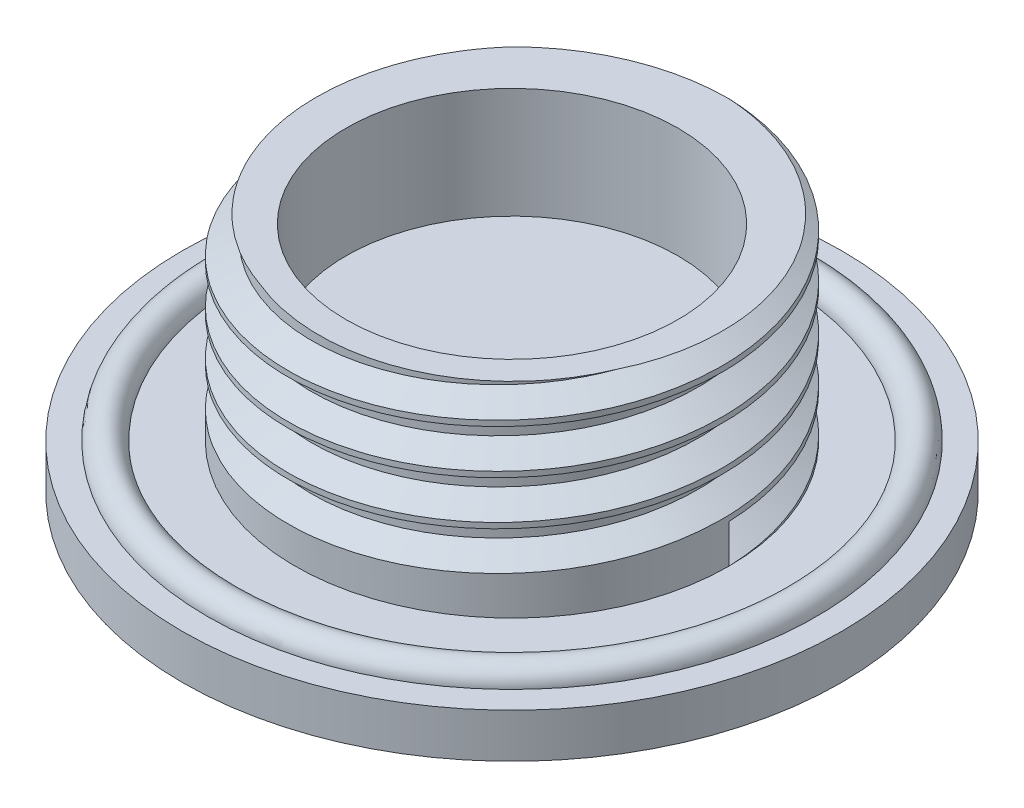
from build123d import *
from build123d.topology import SkipClean

# Parameters (mm, degrees)
SKETCH1_R           = 14.9
BOSS_EXTRUDE1_DEPTH = 2
SKETCH2_R           = 9.8
BOSS_EXTRUDE2_DEPTH = 8.5
SKETCH3_R           = 7.5
CUT_EXTRUDE1_DEPTH  = 5
THREAD1_PITCH       = 2
CUT_EXTRUDE2_START  = -3
SKETCH7_R           = 7.5
CUT_EXTRUDE2_DEPTH  = 3
SKETCH9_W           = 3.4
SKETCH9_H           = 17.333603835
BOSS_EXTRUDE3_DEPTH = 3
SKETCH10_R          = 0.75


with BuildPart() as part:
    # Sketch1 → Boss-Extrude1 (new body)
    with BuildSketch(Plane(origin=(0, 0, 0), x_dir=(1, 0, 0), z_dir=(0, 1, 0))):
        with Locations(Location((0, 0, 0), (0, 0, 270))):
            Circle(SKETCH1_R)
    extrude(amount=BOSS_EXTRUDE1_DEPTH)

    # Sketch2 → Boss-Extrude2 (add)
    with BuildSketch(Plane(origin=(0, 2, 0), x_dir=(1, 0, 0), z_dir=(0, 1, 0))):
        with Locations(Location((0, 0, 0), (0, 0, 270))):
            Circle(SKETCH2_R)
    extrude(amount=BOSS_EXTRUDE2_DEPTH)

    # Sketch3 → Cut-Extrude1 (cut)
    with BuildSketch(Plane(origin=(0, 10.5, 0), x_dir=(1, 0, 0), z_dir=(0, 1, 0))):
        with Locations(Location((0, 0, 0), (0, 0, 270))):
            Circle(SKETCH3_R)
    extrude(amount=-CUT_EXTRUDE1_DEPTH, mode=Mode.SUBTRACT)

    # Thread1: the profile of Sketch5 profile screwed along a right-hand helix of 5 turns, 10 arcs to a turn; built about Z, then put on its axis
    with SkipClean():  # the faces are left unmerged after this step: merging them gives an invalid solid
        thread1_z = Axis((0, 0, 0), (0, 0, 1))
        thread1_corners = [(9.8003, 0, -0.000173205), (9.8003, 0, 1.7501732), (8.71746825, 0, 1.124999997), (8.71746825, 0, 0.624999997)]
        with BuildLine(mode=Mode.PRIVATE) as thread1_profile:
            Line(thread1_corners[0], thread1_corners[1])
            Line(thread1_corners[1], thread1_corners[2])
            Line(thread1_corners[2], thread1_corners[3])
            Line(thread1_corners[3], thread1_corners[0])
        thread1_cap = Face(thread1_profile.wire())
        thread1_turn_angles = [0, 18, 36, 54, 72, 90, 108, 126, 144, 162, 180, 198, 216, 234, 252, 270, 288, 306, 324, 342, 360]
        thread1_turn_weights = [1, 0.9510565162951535, 1, 0.9510565162951535, 1, 0.9510565162951535, 1, 0.9510565162951535, 1, 0.9510565162951535, 1, 0.9510565162951535, 1, 0.9510565162951535, 1, 0.9510565162951535, 1, 0.9510565162951535, 1, 0.9510565162951535, 1]
        thread1_turn_rails = [Edge.make_bspline([Vector(p[0], p[1], 0).rotate(thread1_z, thread1_turn_angles[k]) / thread1_turn_weights[k] + Vector(0, 0, p[2] + THREAD1_PITCH * thread1_turn_angles[k] / 360) for k in range(21)], [0, 0, 0, 1, 1, 2, 2, 3, 3, 4, 4, 5, 5, 6, 6, 7, 7, 8, 8, 9, 9, 10, 10, 10], 2, thread1_turn_weights) for p in thread1_corners]
        thread1_turn_sides = [Face.make_surface_from_curves(thread1_turn_rails[p[0]], thread1_turn_rails[p[1]]) for p in [(0, 1), (1, 2), (2, 3), (3, 0)]]
        thread1 = Plane(origin=(0, 2, 0), x_dir=(1, 0, 0), z_dir=(0, 1, 0)) * Solid(Shell([*[p.moved(Location((0, 0, THREAD1_PITCH * i))) for i in range(5) for p in thread1_turn_sides], thread1_cap, thread1_cap.rotate(thread1_z, 1800).moved(Location((0, 0, THREAD1_PITCH * 1800 / 360)))]))
        add(thread1, mode=Mode.SUBTRACT)

    # Sketch7 → Cut-Extrude2 (cut)
    with SkipClean():  # the faces are left unmerged after this step: merging them gives an invalid solid
        with BuildSketch(Plane.XZ.offset(CUT_EXTRUDE2_START)):
            with Locations(Location((0, 0, 0), (0, 0, 90))):
                Circle(SKETCH7_R)
        extrude(amount=CUT_EXTRUDE2_DEPTH, mode=Mode.SUBTRACT)

    # Sketch9 → Boss-Extrude3 (add)
    with SkipClean():  # the faces are left unmerged after this step: merging them gives an invalid solid
        with BuildSketch(Plane.XZ.offset(-3)):
            with Locations((0, -0.102687227)):
                Rectangle(SKETCH9_W, SKETCH9_H)
        extrude(amount=BOSS_EXTRUDE3_DEPTH)

    # Sketch10 → Revolve1 (revolve)
    with SkipClean():  # the faces are left unmerged after this step: merging them gives an invalid solid
        with BuildSketch(Plane.XY, mode=Mode.PRIVATE) as revolve1_sk:
            with Locations((13, 2)):
                Circle(SKETCH10_R)
        revolve(revolve1_sk.sketch.rotate(Axis((0, 0, 0), (0, 1, 0)), 90), axis=Axis((0, 0, 0), (0, 1, 0)))


solid = part.part
